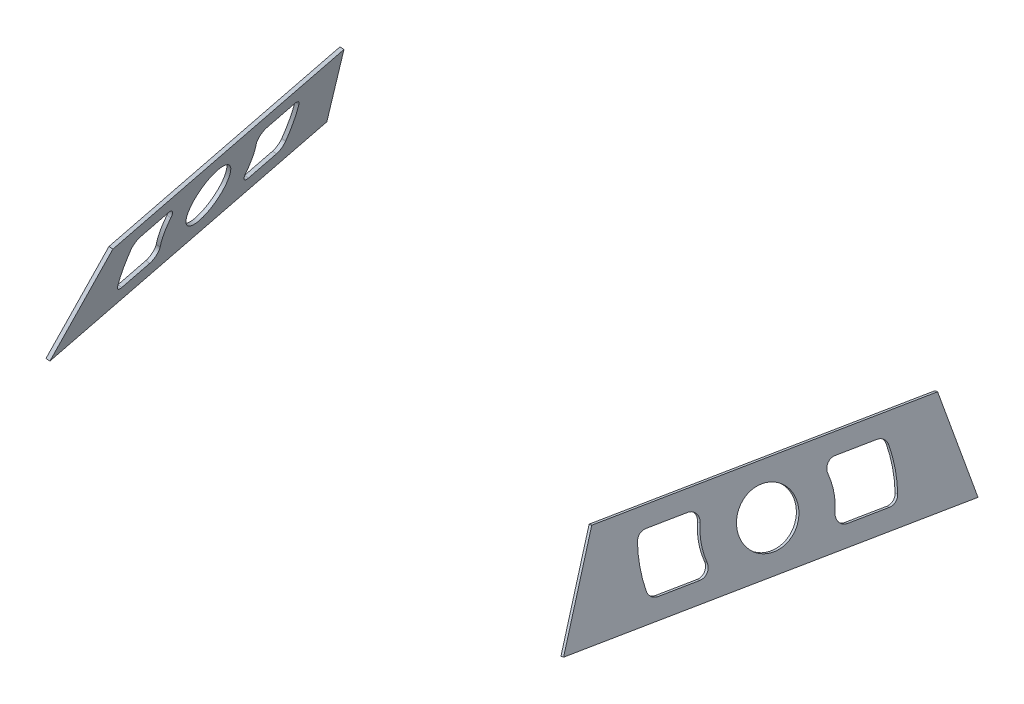
from build123d import *

# Parameters (mm, degrees)
BOSS_EXTRUDE1_DEPTH     = 2
CUT_EXTRUDE4_DEPTH      = 1783.373892428
CUT_EXTRUDE4_DEPTH_BACK = 1783.373892428
SKETCH3_R               = 15
CUT_EXTRUDE5_DEPTH      = 1783.287445841
CUT_EXTRUDE5_DEPTH_BACK = 1783.287445841


with BuildPart() as part:
    # Sketch1 → Boss-Extrude1 (new body)
    with BuildSketch(Plane(origin=(-659.614198676, 210.630673215, 131.193827815), x_dir=(-0.17733557040624176, 0.056627511437048535, -0.9825199338523061), z_dir=(0.9359591821601224, -0.2988742708017783, -0.1861574053935545))):
        Polygon((-1393.93126095, 796.442353721), (-1387.107384854, 745.948447334), (-1589.678471357, 757.99020856), (-1562.978977596, 806.49133097), align=None)
    extrude(amount=-BOSS_EXTRUDE1_DEPTH)

    # Sketch3 → Cut-Extrude4 (cut, two sides: drawn at the far end of the back side and taken through both)
    with BuildSketch(Plane(origin=(-647.727517063, 206.834969975, 128.829628767), x_dir=(-0.17733557040624176, 0.056627511437048535, -0.9825199338523061), z_dir=(0.9359591821601224, -0.2988742708017783, -0.1861574053935545)).offset(-CUT_EXTRUDE4_DEPTH_BACK)):
        with Locations((-1483.424023689, 776.718085146)):
            Circle(SKETCH3_R)
    extrude(amount=CUT_EXTRUDE4_DEPTH + CUT_EXTRUDE4_DEPTH_BACK, mode=Mode.SUBTRACT)

    # Sketch6 → Cut-Extrude5 (cut, two sides: drawn at the far end of the back side and taken through both)
    with BuildSketch(Plane(origin=(-661.48611704, 211.228421756, 131.566142626), x_dir=(0.17733557040624248, -0.05662751143704847, 0.982519933852306), z_dir=(-0.9359591821601227, 0.298874270801777, 0.1861574053935552)).offset(-CUT_EXTRUDE5_DEPTH_BACK)):
        with BuildLine():
            Line((1446.574766594, 789.554074167), (1426.116791028, 788.337957587))
            ThreePointArc((1426.116791028, 788.337957587), (1422.982372867, 786.983722163), (1421.448026269, 783.933425242))
            ThreePointArc((1421.448026269, 783.933425242), (1421.118544819, 773.027161308), (1422.690830395, 762.229797319))
            ThreePointArc((1422.690830395, 762.229797319), (1424.572057657, 759.368085016), (1427.853569511, 758.388241524))
            Line((1427.853569511, 758.388241524), (1448.286940124, 759.602895472))
            ThreePointArc((1448.286940124, 759.602895472), (1452.137251214, 761.800824117), (1452.727052349, 766.194902))
            ThreePointArc((1452.727052349, 766.194902), (1451.067215368, 774.782216154), (1451.757447486, 783.501195612))
            ThreePointArc((1451.757447486, 783.501195612), (1450.66945389, 787.814851695), (1446.574766594, 789.554074167))
        make_face()
        with BuildLine():
            Line((1518.663078212, 793.839336445), (1539.121053778, 795.055453025))
            ThreePointArc((1539.121053778, 795.055453025), (1542.393835076, 794.082091137), (1544.27874665, 791.235050718))
            ThreePointArc((1544.27874665, 791.235050718), (1545.897979428, 780.44462736), (1545.615936818, 769.537033538))
            ThreePointArc((1545.615936818, 769.537033538), (1544.086986772, 766.472604542), (1540.94466742, 765.110898845))
            Line((1540.94466742, 765.110898845), (1520.511296807, 763.896244898))
            ThreePointArc((1520.511296807, 763.896244898), (1516.427711366, 765.622546079), (1515.321494808, 769.915804836))
            ThreePointArc((1515.321494808, 769.915804836), (1515.952298188, 778.639285235), (1514.233984221, 787.215089587))
            ThreePointArc((1514.233984221, 787.215089587), (1514.803274243, 791.627262264), (1518.663078212, 793.839336445))
        make_face()
    extrude(amount=CUT_EXTRUDE5_DEPTH + CUT_EXTRUDE5_DEPTH_BACK, mode=Mode.SUBTRACT)


with BuildPart() as body_2:
    # Mirror5: mirrored copy
    add(part.part.mirror(Plane(origin=(0, 0, 0), x_dir=(0, 0, 1), z_dir=(1, 0, 0))))


solid = Compound([part.part, body_2.part])
